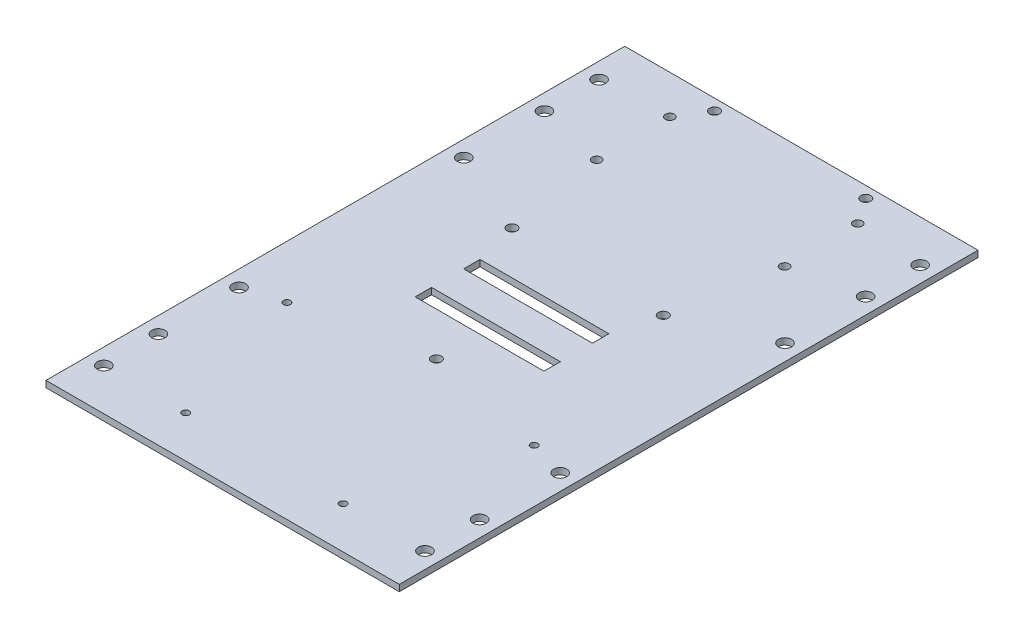
from build123d import *

# Parameters (mm, degrees)
SKETCH1_W           = 55
SKETCH1_H           = 90.1
SKETCH1_R           = 2.05
BOSS_EXTRUDE2_DEPTH = 2
MIRROR1_OUTLINE_W   = 55
MIRROR1_OUTLINE_H   = 90.1
MIRROR1_OUTLINE_R   = 2.05
MIRROR1_DEPTH       = 2
SKETCH2_W           = 40.1
SKETCH2_H           = 5.1
CUT_EXTRUDE1_DEPTH  = 10
SKETCH3_R           = 1.1
SKETCH3_R_2         = 1.55
SKETCH3_R_3         = 1.390793096
SKETCH3_R_4         = 1.407266862
SKETCH3_R_5         = 1.402510713
SKETCH3_R_6         = 1.408268023
CUT_EXTRUDE2_DEPTH  = 10


# Read off the part's stored shape, not the designer's step: Mirror1
with BuildPart() as part:
    # Sketch1 → Boss-Extrude2 (new body)
    with BuildSketch(Plane(origin=(0, 0, 0), x_dir=(1, 0, 0), z_dir=(0, 1, 0))):
        with Locations((27.5, 45.05)):
            Rectangle(SKETCH1_W, SKETCH1_H)
        with Locations(Location((50, 77.1, 0), (0, 0, 270))):
            Circle(SKETCH1_R, mode=Mode.SUBTRACT)
        with Locations(Location((50, 60.1, 0), (0, 0, 270))):
            Circle(SKETCH1_R, mode=Mode.SUBTRACT)
        with Locations(Location((50, 35, 0), (0, 0, 270))):
            Circle(SKETCH1_R, mode=Mode.SUBTRACT)
    extrude(amount=BOSS_EXTRUDE2_DEPTH)

    # Mirror1 outline → Mirror1 (add)
    with BuildSketch(Plane(origin=(0, 0, 0), x_dir=(1, 0, 0), z_dir=(0, 1, 0))):
        with Locations((-27.5, 45.05)):
            Rectangle(MIRROR1_OUTLINE_W, MIRROR1_OUTLINE_H)
        with Locations((-50, 35)):
            Circle(MIRROR1_OUTLINE_R, mode=Mode.SUBTRACT)
        with Locations((-50, 60.1)):
            Circle(MIRROR1_OUTLINE_R, mode=Mode.SUBTRACT)
        with Locations((-50, 77.1)):
            Circle(MIRROR1_OUTLINE_R, mode=Mode.SUBTRACT)
    extrude(amount=MIRROR1_DEPTH)

    # Mirror2: part across plane


with BuildPart() as part_1:
    add(part.part)
    add(part.part.mirror(Plane(origin=(0, 2, 0), x_dir=(1, 0, 0), z_dir=(0, 0, -1))))

    # Sketch2 → Cut-Extrude1 (cut)
    with BuildSketch(Plane(origin=(0, 2, 0), x_dir=(1, 0, 0), z_dir=(0, 1, 0))):
        with Locations((0, 7.55)):
            Rectangle(SKETCH2_W, SKETCH2_H)
        with Locations((0, -7.55)):
            Rectangle(SKETCH2_W, SKETCH2_H)
    extrude(amount=-CUT_EXTRUDE1_DEPTH, mode=Mode.SUBTRACT)

    # Sketch3 → Cut-Extrude2 (cut)
    with BuildSketch(Plane(origin=(0, 2, 0), x_dir=(1, 0, 0), z_dir=(0, 1, 0))):
        with Locations(Location((-24.5, -77.1, 0), (0, 0, 270))):
            Circle(SKETCH3_R)
        with Locations(Location((24.5, -77.1, 0), (0, 0, 270))):
            Circle(SKETCH3_R)
        with Locations(Location((-38.5, -31.6, 0), (0, 0, 270))):
            Circle(SKETCH3_R)
        with Locations(Location((38.5, -31.6, 0), (0, 0, 270))):
            Circle(SKETCH3_R)
        with Locations(Location((23.55, 86.6, 0), (0, 0, 270))):
            Circle(SKETCH3_R_2)
        with Locations(Location((23.55, 23.55, 0), (0, 0, 270))):
            Circle(SKETCH3_R_2)
        with Locations(Location((-23.55, 86.6, 0), (0, 0, 270))):
            Circle(SKETCH3_R_2)
        with Locations(Location((-23.55, 23.55, 0), (0, 0, 270))):
            Circle(SKETCH3_R_2)
        with Locations(Location((0, -23.55, 0), (0, 0, 270))):
            Circle(SKETCH3_R_2)
        with Locations(Location((29.072459347, 78.586687626, 0), (0, 0, 270))):
            Circle(SKETCH3_R_3)
        with Locations(Location((29.255411637, 55.616498658, 0), (0, 0, 270))):
            Circle(SKETCH3_R_4)
        with Locations(Location((-28.941884451, 78.099990066, 0), (0, 0, 270))):
            Circle(SKETCH3_R_5)
        with Locations(Location((-28.741560934, 55.107175023, 0), (0, 0, 270))):
            Circle(SKETCH3_R_6)
    extrude(amount=-CUT_EXTRUDE2_DEPTH, mode=Mode.SUBTRACT)


solid = part_1.part
